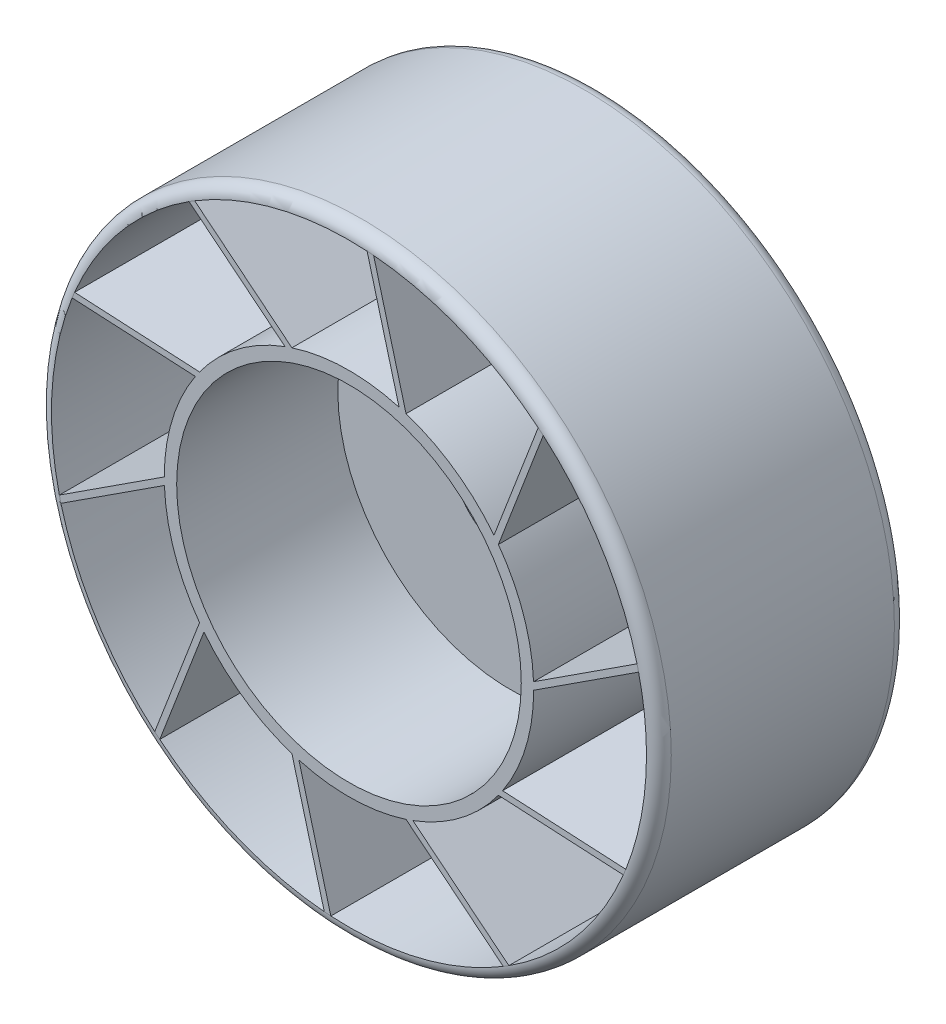
from build123d import *

# Parameters (mm, degrees)
SKETCH1_R           = 25
SKETCH1_R_2         = 13.9
BOSS_EXTRUDE1_DEPTH = 20
FILLET1_R           = 1
SKETCH2_R           = 13.9
BOSS_EXTRUDE2_DEPTH = 7
SKETCH3_R           = 4.125
CUT_EXTRUDE1_DEPTH  = 3
SKETCH4_R           = 4.6
CUT_EXTRUDE2_DEPTH  = 2.3


with BuildPart() as part:
    # Sketch1 → Boss-Extrude1 (new body)
    with BuildSketch(Plane.XY):
        Circle(SKETCH1_R)
        Circle(SKETCH1_R_2, mode=Mode.SUBTRACT)
        with BuildLine():
            Line((14.9, 0), (23.361961312, 5.497159601))
            ThreePointArc((23.361961312, 5.497159601), (23.937761526, -1.727302272), (22.330720685, -8.794254584))
            Line((22.330720685, -8.794254584), (12.390961728, -8.274905888))
            ThreePointArc((12.390961728, -8.274905888), (14.258950343, -4.323463325), (14.9, 0))
        make_face(mode=Mode.SUBTRACT)
        with BuildLine():
            Line((14.88836626, 0.588685076), (23.23506568, 6.010966881))
            ThreePointArc((23.23506568, 6.010966881), (20.381338683, 12.672846305), (15.66907438, 18.179111861))
            Line((15.66907438, 18.179111861), (12.054353216, 8.758000259))
            ThreePointArc((12.054353216, 8.758000259), (14.077001131, 4.88344542), (14.88836626, 0.588685076))
        make_face(mode=Mode.SUBTRACT)
        with BuildLine():
            Line((12.054353216, -8.758000259), (22.131373066, -9.284520786))
            ThreePointArc((22.131373066, -9.284520786), (18.35077308, -15.46768009), (12.896799382, -20.240369703))
            Line((12.896799382, -20.240369703), (5.16063097, -13.977764056))
            ThreePointArc((5.16063097, -13.977764056), (8.994465168, -11.878956029), (12.054353216, -8.758000259))
        make_face(mode=Mode.SUBTRACT)
        with BuildLine():
            Line((4.604353216, -14.170742093), (12.447352527, -20.519829801))
            ThreePointArc((12.447352527, -20.519829801), (5.754413037, -23.299929841), (-1.46326094, -23.95535154))
            Line((-1.46326094, -23.95535154), (-4.040885415, -14.341591441))
            ThreePointArc((-4.040885415, -14.341591441), (0.294400009, -14.897091281), (4.604353216, -14.170742093))
        make_face(mode=Mode.SUBTRACT)
        with BuildLine():
            Line((-4.604353216, -14.170742093), (-1.991133608, -23.917261276))
            ThreePointArc((-1.991133608, -23.917261276), (-9.0399372, -22.232398328), (-15.264405316, -18.520203302))
            Line((-15.264405316, -18.520203302), (-11.698920917, -9.227418349))
            ThreePointArc((-11.698920917, -9.227418349), (-8.518115946, -12.225043997), (-4.604353216, -14.170742093))
        make_face(mode=Mode.SUBTRACT)
        with BuildLine():
            Line((-12.054353216, -8.758000259), (-15.66907438, -18.179111861))
            ThreePointArc((-15.66907438, -18.179111861), (-20.381338683, -12.672846305), (-23.23506568, -6.010966881))
            Line((-23.23506568, -6.010966881), (-14.88836626, -0.588685076))
            ThreePointArc((-14.88836626, -0.588685076), (-14.077001131, -4.88344542), (-12.054353216, -8.758000259))
        make_face(mode=Mode.SUBTRACT)
        with BuildLine():
            Line((-14.9, 0), (-23.361961312, -5.497159601))
            ThreePointArc((-23.361961312, -5.497159601), (-23.937761526, 1.727302272), (-22.330720685, 8.794254584))
            Line((-22.330720685, 8.794254584), (-12.390961728, 8.274905888))
            ThreePointArc((-12.390961728, 8.274905888), (-14.258950343, 4.323463325), (-14.9, 0))
        make_face(mode=Mode.SUBTRACT)
        with BuildLine():
            Line((-12.054353216, 8.758000259), (-22.131373066, 9.284520786))
            ThreePointArc((-22.131373066, 9.284520786), (-18.35077308, 15.46768009), (-12.896799382, 20.240369703))
            Line((-12.896799382, 20.240369703), (-5.16063097, 13.977764056))
            ThreePointArc((-5.16063097, 13.977764056), (-8.994465168, 11.878956029), (-12.054353216, 8.758000259))
        make_face(mode=Mode.SUBTRACT)
        with BuildLine():
            Line((-4.604353216, 14.170742093), (-12.447352527, 20.519829801))
            ThreePointArc((-12.447352527, 20.519829801), (-5.754413037, 23.299929841), (1.46326094, 23.95535154))
            Line((1.46326094, 23.95535154), (4.040885415, 14.341591441))
            ThreePointArc((4.040885415, 14.341591441), (-0.294400009, 14.897091281), (-4.604353216, 14.170742093))
        make_face(mode=Mode.SUBTRACT)
        with BuildLine():
            Line((4.604353216, 14.170742093), (1.991133608, 23.917261276))
            ThreePointArc((1.991133608, 23.917261276), (9.0399372, 22.232398328), (15.264405316, 18.520203302))
            Line((15.264405316, 18.520203302), (11.698920917, 9.227418349))
            ThreePointArc((11.698920917, 9.227418349), (8.518115946, 12.225043997), (4.604353216, 14.170742093))
        make_face(mode=Mode.SUBTRACT)
    extrude(amount=BOSS_EXTRUDE1_DEPTH)

    # Fillet1
    fillet1_edges = [part.edges().sort_by_distance(p)[0] for p in [
        (-25, 0, 0),
        (-25, 0, 20),
    ]]
    fillet(fillet1_edges, radius=FILLET1_R - 0.0001)  # a hair under: the kernel refuses the full size

    # Sketch2 → Boss-Extrude2 (add)
    with BuildSketch(Plane(origin=(0, 0, 0), x_dir=(-1, 0, 0), z_dir=(0, 0, -1))):
        Circle(SKETCH2_R)
    extrude(amount=-BOSS_EXTRUDE2_DEPTH)

    # Sketch3 → Cut-Extrude1 (cut)
    with BuildSketch(Plane(origin=(0, 0, 0), x_dir=(-1, 0, 0), z_dir=(0, 0, -1))):
        Circle(SKETCH3_R)
    extrude(amount=-CUT_EXTRUDE1_DEPTH, mode=Mode.SUBTRACT)

    # Sketch4 → Cut-Extrude2 (cut)
    with BuildSketch(Plane.XY.offset(7)):
        Circle(SKETCH4_R)
    extrude(amount=-CUT_EXTRUDE2_DEPTH, mode=Mode.SUBTRACT)


solid = part.part
